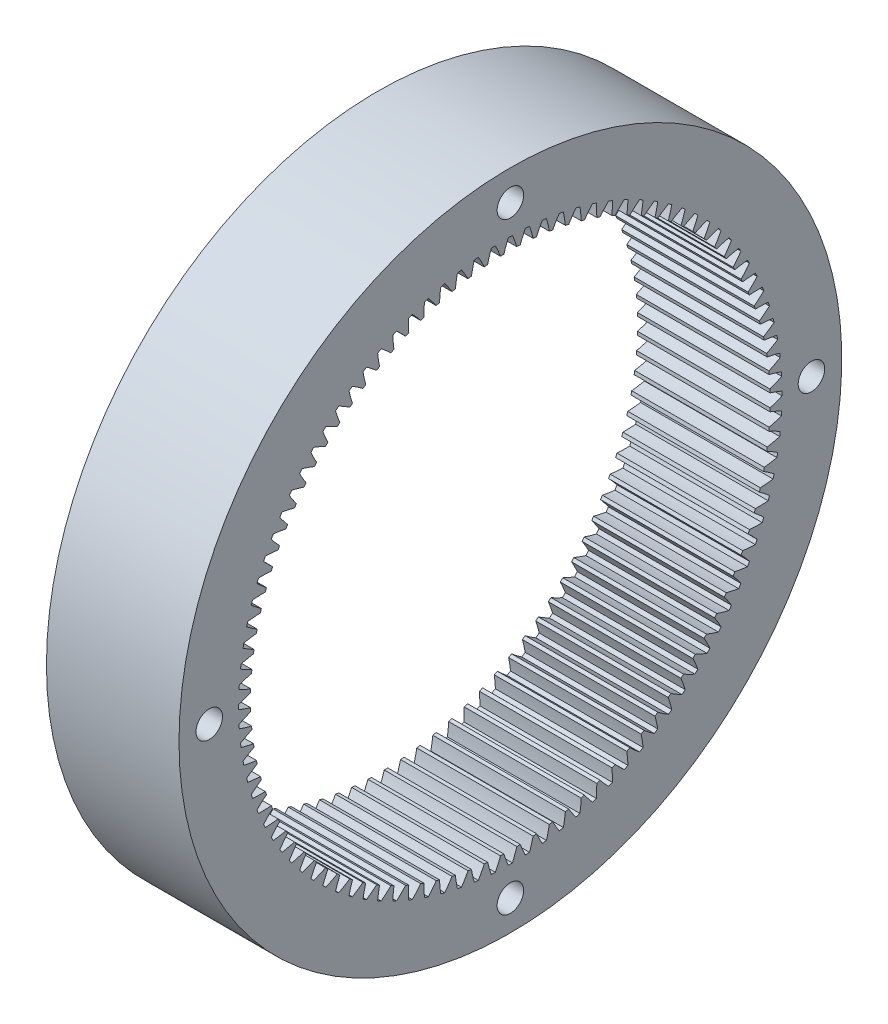
from build123d import *

# Parameters (mm, degrees)
BASPROSKE_W        = 10
BASPROSKE_H        = 5.4
TOOTHCUT_DEPTH     = 37.742346142
TEETHCUTS_COUNT    = 100
TEETHCUTS_ANGLE    = 356.4
SKETCH1_R          = 1
CUT_EXTRUDE1_DEPTH = 37.742346142


with BuildPart() as part:
    # BasProSke → Base-Revolve (revolve)
    with BuildSketch(Plane(origin=(0, 0, 0), x_dir=(1, 0, 0), z_dir=(0, 1, 0))):
        with Locations((5, 22.3)):
            Rectangle(BASPROSKE_W, BASPROSKE_H)
    revolve(axis=Axis((-10, 0, 0), (1, 0, 0)))

    # TooCutSke → ToothCut (cut, through all)
    with BuildSketch(Plane(origin=(0, 0, 0), x_dir=(0, 0, -1), z_dir=(1, 0, 0))):
        with BuildLine():
            ThreePointArc((0.493653577, 19.568374263), (0.33668613, 20.038566117), (0.15661125, 20.500401799))
            ThreePointArc((0.15661125, 20.500401799), (0, 20.501), (-0.15661125, 20.500401799))
            ThreePointArc((-0.15661125, 20.500401799), (-0.33668613, 20.038566117), (-0.493653577, 19.568374263))
            ThreePointArc((-0.493653577, 19.568374263), (0, 19.5746), (0.493653577, 19.568374263))
        make_face()
    toothcut = extrude(amount=TOOTHCUT_DEPTH, mode=Mode.SUBTRACT)

    # TeethCuts: ToothCut ×100 about axis
    teethcuts_axis = Axis((-10, 0, 0), (1, 0, 0))
    for i in range(1, TEETHCUTS_COUNT):
        add(toothcut.rotate(teethcuts_axis, i * TEETHCUTS_ANGLE / (TEETHCUTS_COUNT - 1)), mode=Mode.SUBTRACT)

    # Sketch1 → Cut-Extrude1 (cut, through all)
    with BuildSketch(Plane(origin=(10, 0, 0), x_dir=(0, 0, -1), z_dir=(1, 0, 0))):
        with Locations((0, 22.715)):
            Circle(SKETCH1_R)
        with Locations((22.715, 0)):
            Circle(SKETCH1_R)
        with Locations((0, -22.715)):
            Circle(SKETCH1_R)
        with Locations((-22.715, 0)):
            Circle(SKETCH1_R)
    extrude(amount=-CUT_EXTRUDE1_DEPTH, mode=Mode.SUBTRACT)


solid = part.part
